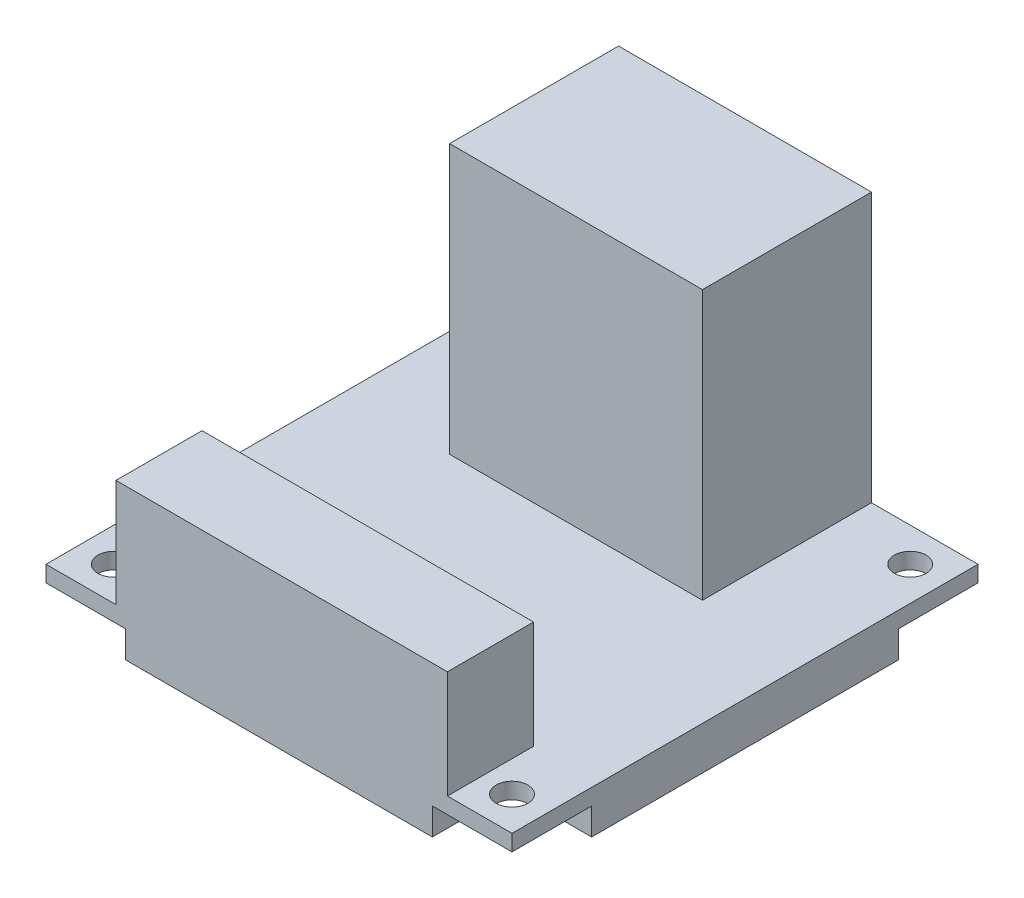
from build123d import *

# Parameters (mm, degrees)
SKETCH1_W           = 43.3
SKETCH1_H           = 43.3
SKETCH1_R           = 1.475
BOSS_EXTRUDE1_DEPTH = 1.5
BOSS_EXTRUDE2_DEPTH = 2.5
SKETCH3_W           = 30.8
SKETCH3_H           = 8
BOSS_EXTRUDE3_DEPTH = 10
SKETCH4_W           = 23.5
SKETCH4_H           = 15.7
BOSS_EXTRUDE4_DEPTH = 25


with BuildPart() as part:
    # Sketch1 → Boss-Extrude1 (new body)
    with BuildSketch(Plane(origin=(0, 0, 0), x_dir=(1, 0, 0), z_dir=(0, 1, 0))):
        with Locations((21.65, 21.65)):
            Rectangle(SKETCH1_W, SKETCH1_H)
        with Locations((3.15, 3.15)):
            Circle(SKETCH1_R, mode=Mode.SUBTRACT)
        with Locations((3.15, 40.15)):
            Circle(SKETCH1_R, mode=Mode.SUBTRACT)
        with Locations((40.15, 40.15)):
            Circle(SKETCH1_R, mode=Mode.SUBTRACT)
        with Locations((40.15, 3.15)):
            Circle(SKETCH1_R, mode=Mode.SUBTRACT)
    extrude(amount=BOSS_EXTRUDE1_DEPTH)

    # Sketch2 → Boss-Extrude2 (add)
    with BuildSketch(Plane.XZ):
        Polygon((0, -35.9), (0, -7.4), (7.4, -7.4), (7.4, 0), (35.9, 0), (35.9, -7.4), (43.3, -7.4), (43.3, -35.9), (35.9, -35.9), (35.9, -43.3), (7.4, -43.3), (7.4, -35.9), align=None)
    extrude(amount=BOSS_EXTRUDE2_DEPTH)

    # Sketch3 → Boss-Extrude3 (add)
    with BuildSketch(Plane(origin=(0, 1.5, 0), x_dir=(1, 0, 0), z_dir=(0, 1, 0))):
        with Locations((21.9, 4)):
            Rectangle(SKETCH3_W, SKETCH3_H)
    extrude(amount=BOSS_EXTRUDE3_DEPTH)

    # Sketch4 → Boss-Extrude4 (add)
    with BuildSketch(Plane(origin=(0, 1.5, 0), x_dir=(1, 0, 0), z_dir=(0, 1, 0))):
        with Locations((21.65, 35.45)):
            Rectangle(SKETCH4_W, SKETCH4_H)
    extrude(amount=BOSS_EXTRUDE4_DEPTH)


solid = part.part
